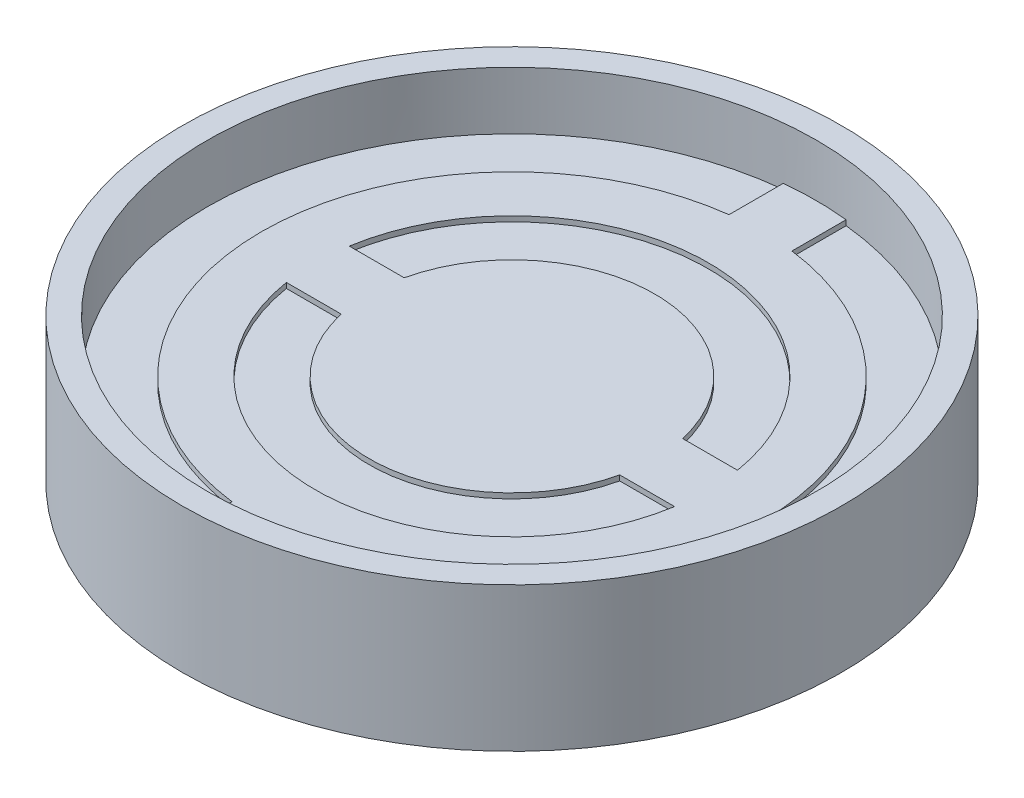
from build123d import *

# Parameters (mm, degrees)
SKETCH1_R           = 15.9639
BOSS_EXTRUDE1_DEPTH = 3.4925
SKETCH2_R           = 14.7447
CUT_EXTRUDE1_DEPTH  = 2.794
BOSS_EXTRUDE2_START = 0.254
BOSS_EXTRUDE2_DEPTH = 0.254


with BuildPart() as part:
    # Sketch1 → Boss-Extrude1 (new, symmetric)
    with BuildSketch(Plane(origin=(0, 0, 0), x_dir=(1, 0, 0), z_dir=(0, 1, 0))):
        Circle(SKETCH1_R)
    extrude(amount=BOSS_EXTRUDE1_DEPTH, both=True)

    # Sketch2 → Cut-Extrude1 (cut)
    with BuildSketch(Plane(origin=(0, 3.4925, 0), x_dir=(1, 0, 0), z_dir=(0, 1, 0))):
        Circle(SKETCH2_R)
    cut_extrude1 = extrude(amount=-CUT_EXTRUDE1_DEPTH, mode=Mode.SUBTRACT)

    # Sketch3 → Boss-Extrude2 (add)
    with BuildSketch(Plane(origin=(0, 0.6985, 0), x_dir=(1, 0, 0), z_dir=(0, 1, 0)).offset(BOSS_EXTRUDE2_START)):
        with BuildLine():
            ThreePointArc((1.524, 14.665728829), (0, 14.7447), (-1.524, 14.665728829))
            Line((-1.524, 14.665728829), (-1.524, 12.038771055))
            ThreePointArc((-1.524, 12.038771055), (-12.13485, 0), (-1.524, -12.038771055))
            Line((-1.524, -12.038771055), (-1.524, -14.665728829))
            ThreePointArc((-1.524, -14.665728829), (0, -14.7447), (1.524, -14.665728829))
            Line((1.524, -14.665728829), (1.524, -12.038771055))
            ThreePointArc((1.524, -12.038771055), (12.13485, 0), (1.524, 12.038771055))
            Line((1.524, 12.038771055), (1.524, 14.665728829))
        make_face()
        with BuildLine():
            ThreePointArc((-9.402289562, 1.524), (0, 9.525), (9.402289562, 1.524))
            Line((9.402289562, 1.524), (6.745125909, 1.524))
            ThreePointArc((6.745125909, 1.524), (0, 6.91515), (-6.745125909, 1.524))
            Line((-6.745125909, 1.524), (-9.402289562, 1.524))
        make_face(mode=Mode.SUBTRACT)
        with BuildLine():
            ThreePointArc((9.402289562, -1.524), (0, -9.525), (-9.402289562, -1.524))
            Line((-9.402289562, -1.524), (-6.745125909, -1.524))
            ThreePointArc((-6.745125909, -1.524), (0, -6.91515), (6.745125909, -1.524))
            Line((6.745125909, -1.524), (9.402289562, -1.524))
        make_face(mode=Mode.SUBTRACT)
    boss_extrude2 = extrude(amount=-BOSS_EXTRUDE2_DEPTH)

    # Mirror1: Cut-Extrude1, Boss-Extrude2 across plane
    add(cut_extrude1.mirror(Plane.ZX), mode=Mode.SUBTRACT)
    add(boss_extrude2.mirror(Plane.ZX))


solid = part.part
